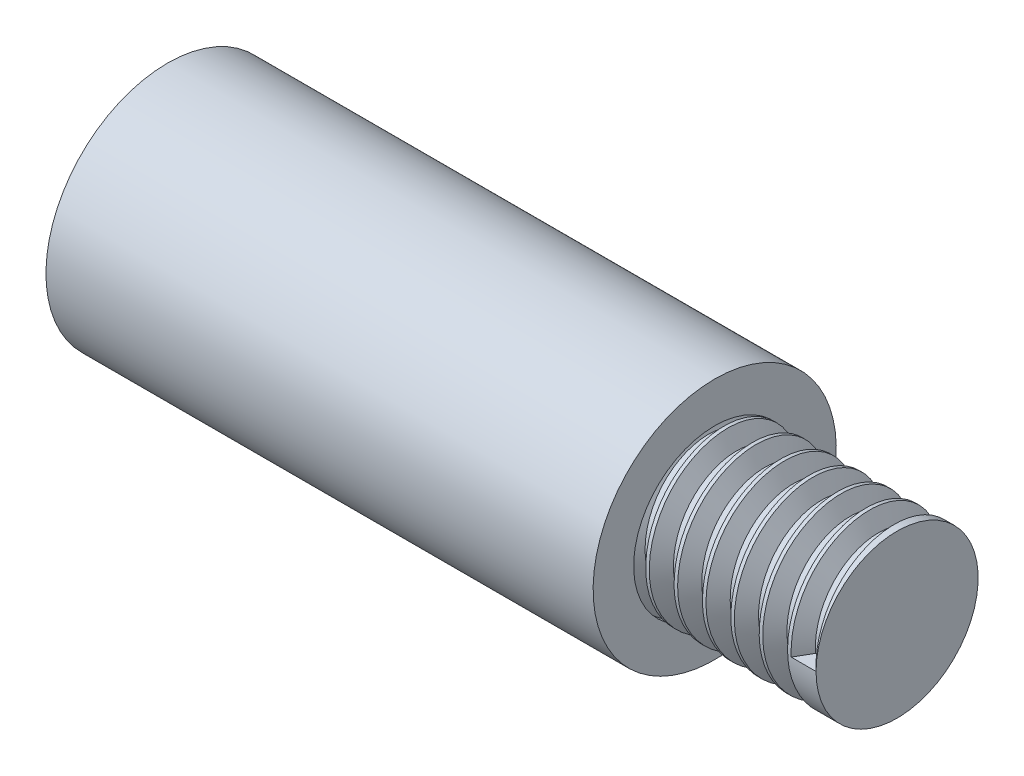
from build123d import *

# Parameters (mm, degrees)
THREAD1_PITCH = 0.7


with BuildPart() as part:
    # Sketch1 → Revolve1 (revolve)
    with BuildSketch(Plane.XY):
        Polygon((0, 0), (0, 3), (13.5, 3), (13.5, 2), (18, 2), (18, 0), align=None)
    revolve(axis=Axis((18, 0, 0), (-1, 0, 0)))

    # Thread1: the profile of Thread Profile1 profile screwed along a right-hand helix of 6.428571 turns, 6 arcs to a turn; built about Z, then put on its axis
    thread1_z = Axis((0, 0, 0), (0, 0, 1))
    thread1_corners = [(2.0003, 0, -0.000173205), (2.0003, 0, 0.612673203), (1.621113887, 0, 0.393749999), (1.621113887, 0, 0.218749999)]
    with BuildLine(mode=Mode.PRIVATE) as thread1_profile:
        Line(thread1_corners[0], thread1_corners[1])
        Line(thread1_corners[1], thread1_corners[2])
        Line(thread1_corners[2], thread1_corners[3])
        Line(thread1_corners[3], thread1_corners[0])
    thread1_cap = Face(thread1_profile.wire())
    thread1_turn_angles = [0, 30, 60, 90, 120, 150, 180, 210, 240, 270, 300, 330, 360]
    thread1_turn_weights = [1, 0.8660254037844387, 1, 0.8660254037844387, 1, 0.8660254037844387, 1, 0.8660254037844387, 1, 0.8660254037844387, 1, 0.8660254037844387, 1]
    thread1_turn_rails = [Edge.make_bspline([Vector(p[0], p[1], 0).rotate(thread1_z, thread1_turn_angles[k]) / thread1_turn_weights[k] + Vector(0, 0, p[2] + THREAD1_PITCH * thread1_turn_angles[k] / 360) for k in range(13)], [0, 0, 0, 1, 1, 2, 2, 3, 3, 4, 4, 5, 5, 6, 6, 6], 2, thread1_turn_weights) for p in thread1_corners]
    thread1_turn_sides = [Face.make_surface_from_curves(thread1_turn_rails[p[0]], thread1_turn_rails[p[1]]) for p in [(0, 1), (1, 2), (2, 3), (3, 0)]]
    thread1_last_angles = [2160, 2190, 2220, 2250, 2280, 2297.142857143, 2314.285714286]
    thread1_last_weights = [1, 0.8660254037844387, 1, 0.8660254037844387, 1, 0.9555728057861409, 1]
    thread1_last_rails = [Edge.make_bspline([Vector(p[0], p[1], 0).rotate(thread1_z, thread1_last_angles[k]) / thread1_last_weights[k] + Vector(0, 0, p[2] + THREAD1_PITCH * thread1_last_angles[k] / 360) for k in range(7)], [0, 0, 0, 1, 1, 2, 2, 3, 3, 3], 2, thread1_last_weights) for p in thread1_corners]
    thread1_last_sides = [Face.make_surface_from_curves(thread1_last_rails[p[0]], thread1_last_rails[p[1]]) for p in [(0, 1), (1, 2), (2, 3), (3, 0)]]
    thread1 = Plane(origin=(18, 0, 0), x_dir=(0, 0, 1), z_dir=(-1, 0, 0)) * Solid(Shell([*[p.moved(Location((0, 0, THREAD1_PITCH * i))) for i in range(6) for p in thread1_turn_sides], *thread1_last_sides, thread1_cap, thread1_cap.rotate(thread1_z, 2314.285714286).moved(Location((0, 0, THREAD1_PITCH * 2314.285714286 / 360)))]))
    add(thread1, mode=Mode.SUBTRACT)


solid = part.part
